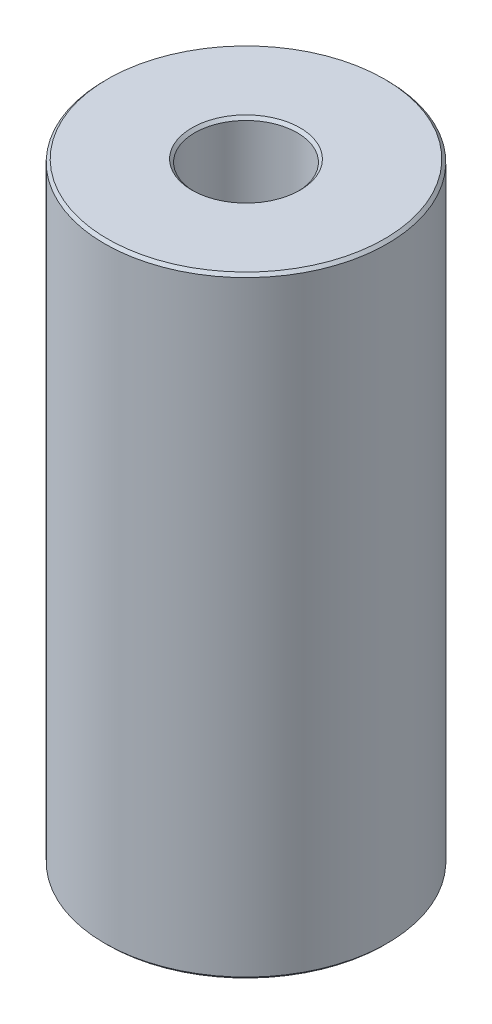
from build123d import *

# Parameters (mm, degrees)
SKETCH1_R           = 17.5
BOSS_EXTRUDE1_DEPTH = 75.721727349
SKETCH2_R           = 6.345843567
CUT_EXTRUDE1_DEPTH  = 80.663542432
CHAMFER1_SIZE       = 0.350058037


with BuildPart() as part:
    # Sketch1 → Boss-Extrude1 (new body)
    with BuildSketch(Plane(origin=(0, 0, 0), x_dir=(1, 0, 0), z_dir=(0, 1, 0))):
        Circle(SKETCH1_R)
    extrude(amount=BOSS_EXTRUDE1_DEPTH)

    # Sketch2 → Cut-Extrude1 (cut, through all)
    with BuildSketch(Plane(origin=(0, 0, 0), x_dir=(1, 0, 0), z_dir=(0, 1, 0))):
        Circle(SKETCH2_R)
    extrude(amount=CUT_EXTRUDE1_DEPTH, mode=Mode.SUBTRACT)

    # Chamfer1
    chamfer1_edges = [part.edges().sort_by_distance(p)[0] for p in [
        (-6.345843567, 75.721727349, 0),
        (-6.345843567, 0, 0),
        (-17.5, 0, 0),
        (-17.5, 75.721727349, 0),
    ]]
    chamfer(chamfer1_edges, length=CHAMFER1_SIZE)


solid = part.part
